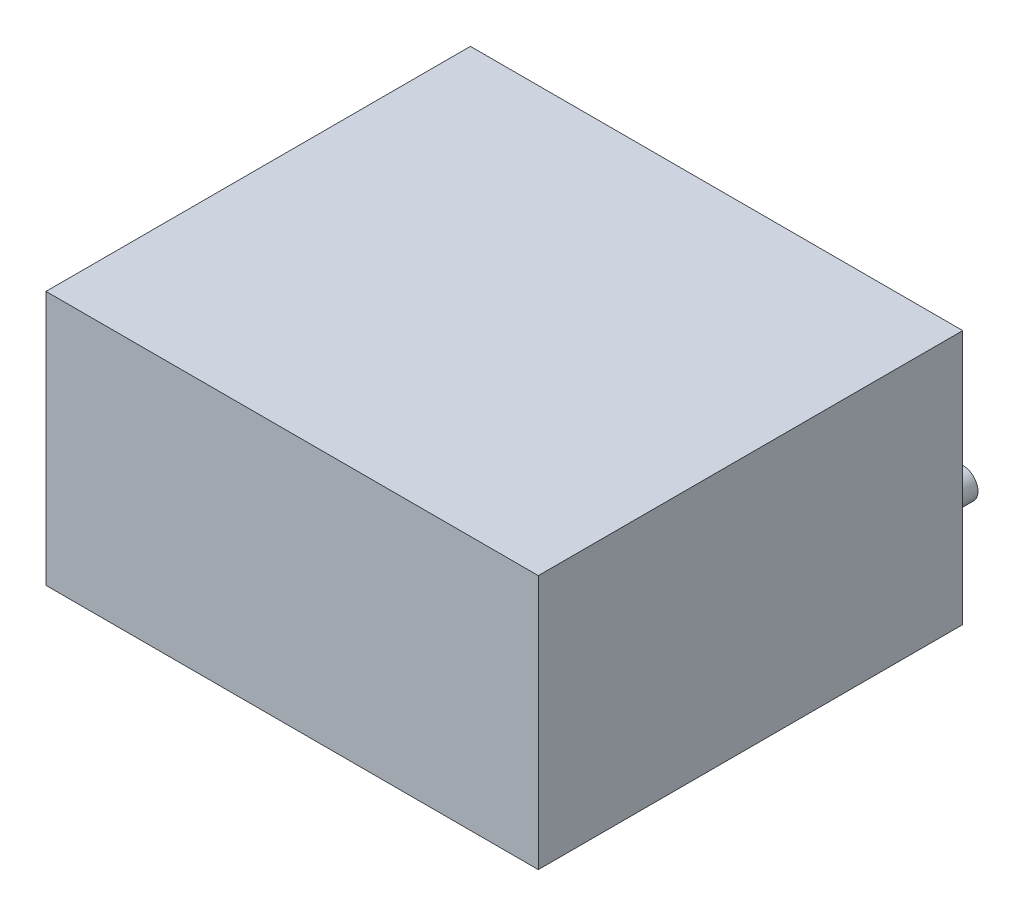
from build123d import *

# Parameters (mm, degrees)
SKETCH_1_W      = 11.6
SKETCH_1_H      = 6
EXTRUDE_1_DEPTH = 10
SKETCH_2_R      = 0.35
EXTRUDE_2_DEPTH = 2


with BuildPart() as part:
    # 草图1 → 凸台-拉伸1 (new body)
    with BuildSketch(Plane.XY):
        with Locations((5.8, 3)):
            Rectangle(SKETCH_1_W, SKETCH_1_H)
    extrude(amount=EXTRUDE_1_DEPTH)

    # 草图2 → 凸台-拉伸2 (add)
    with BuildSketch(Plane(origin=(0, 0, 0), x_dir=(-1, 0, 0), z_dir=(0, 0, -1))):
        with Locations((-7.07, 0.9)):
            Circle(SKETCH_2_R)
        with Locations((-9.61, 0.9)):
            Circle(SKETCH_2_R)
        with Locations((-1.99, 0.9)):
            Circle(SKETCH_2_R)
        with Locations((-4.53, 0.9)):
            Circle(SKETCH_2_R)
    extrude(amount=EXTRUDE_2_DEPTH)


solid = part.part
